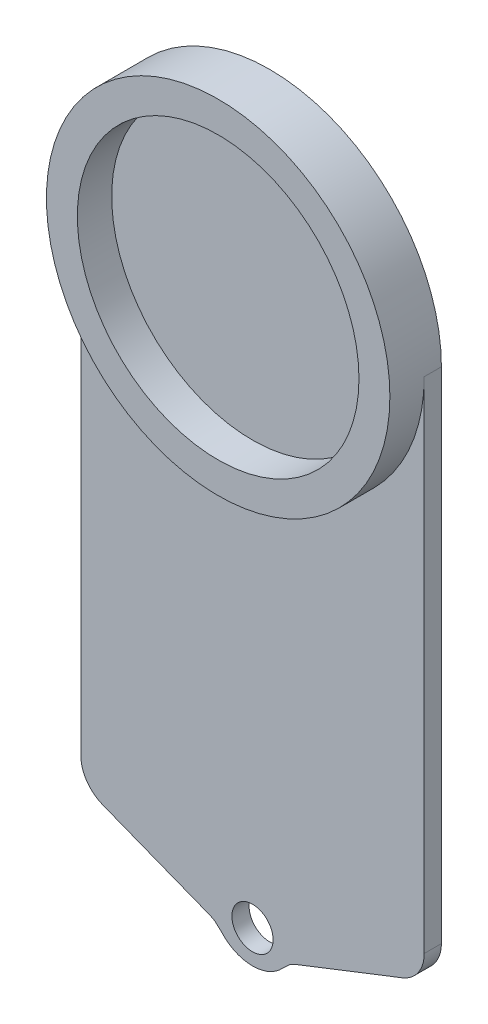
from build123d import *

# Parameters (mm, degrees)
CROQUIS1_R              = 6
SALIENTE_EXTRUIR1_DEPTH = 5
REDONDEO1_R             = 10
REDONDEO3_R             = 10
CROQUIS2_R              = 50
CROQUIS2_R_2            = 41
SALIENTE_EXTRUIR3_DEPTH = 10


with BuildPart() as part:
    # Croquis1 → Saliente-Extruir1 (new body)
    with BuildSketch(Plane.XY):
        with BuildLine():
            ThreePointArc((50, 164), (0, 214), (-50, 164))
            Line((-50, 164), (-50, 11.739233328))
            Line((-50, 11.739233328), (-20, 0))
            Line((-20, 0), (-13.787308542, -2.431074487))
            add(Edge.make_bspline(
                [(-8.854817181, -5.677302066), (-9.51760475, -5.090344722), (-10.900654261, -3.469047842), (-12.711160318, -2.852179657), (-13.787308542, -2.431074487)],
                knots=[0.517708821, 0.517708821, 0.517708821, 0.517708821, 0.741171884, 1, 1, 1, 1], degree=3))
            ThreePointArc((-8.854817181, -5.677302066), (0, -9.578400122), (8.854817181, -5.677302066))
            add(Edge.make_bspline(
                [(8.854817181, -5.677302066), (9.51760475, -5.090344722), (10.900654261, -3.469047842), (12.711160318, -2.852179657), (13.787308542, -2.431074487)],
                knots=[0.517708821, 0.517708821, 0.517708821, 0.517708821, 0.741171884, 1, 1, 1, 1], degree=3))
            Line((13.787308542, -2.431074487), (20, 0))
            Line((20, 0), (50, 11.739233328))
            Line((50, 11.739233328), (50, 164))
        make_face()
        Circle(CROQUIS1_R, mode=Mode.SUBTRACT)
    extrude(amount=SALIENTE_EXTRUIR1_DEPTH)

    # Redondeo1
    redondeo1_edges = [part.edges().sort_by_distance(p)[0] for p in [
        (50, 11.739233328, 2.5),
    ]]
    fillet(redondeo1_edges, radius=REDONDEO1_R)

    # Redondeo3
    redondeo3_edges = [part.edges().sort_by_distance(p)[0] for p in [
        (-50, 11.739233328, 2.5),
    ]]
    fillet(redondeo3_edges, radius=REDONDEO3_R)

    # Croquis2 → Saliente-Extruir3 (add)
    with BuildSketch(Plane.XY.offset(5)):
        with Locations((0, 164)):
            Circle(CROQUIS2_R)
        with Locations((0, 164)):
            Circle(CROQUIS2_R_2, mode=Mode.SUBTRACT)
    extrude(amount=SALIENTE_EXTRUIR3_DEPTH)


solid = part.part
